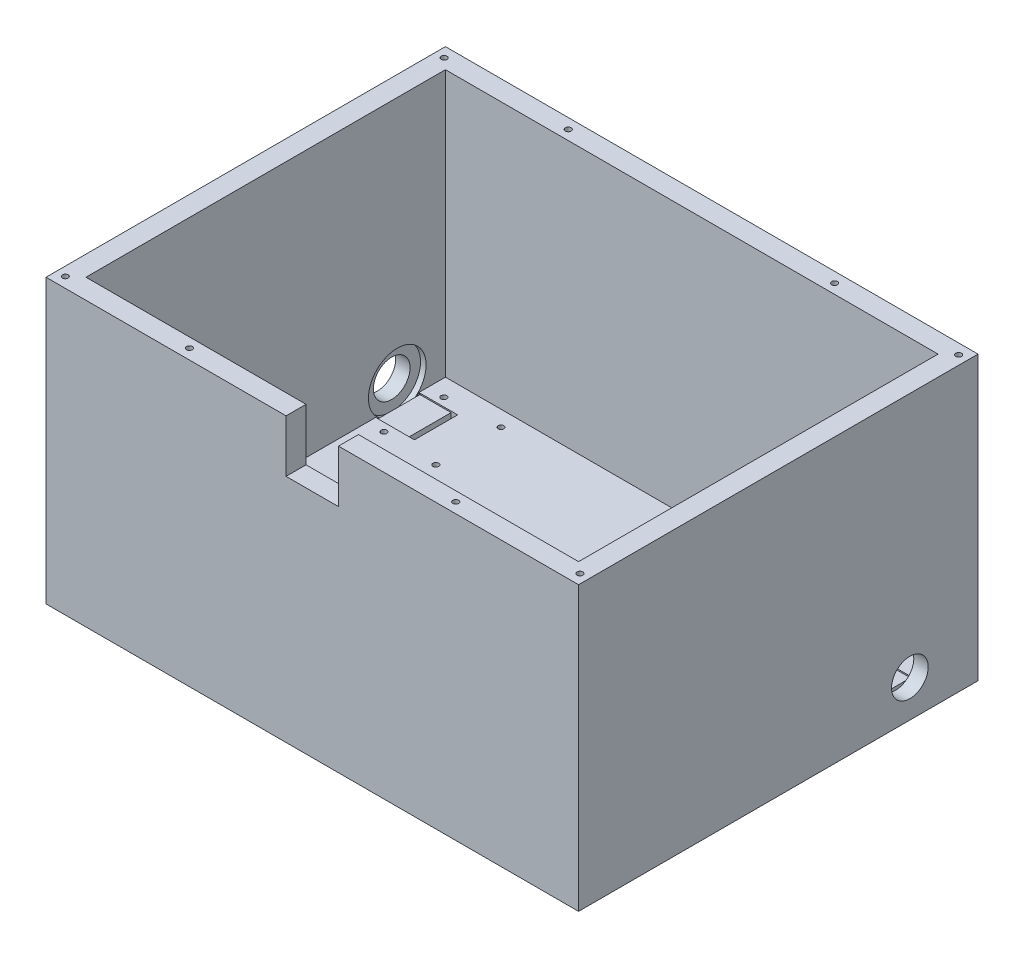
from build123d import *
from build123d.topology import SkipClean

# Parameters (mm, degrees)
BOSS_EXTRUDE1_DEPTH     = 6.35
SKETCH2_W               = 203.2
SKETCH2_H               = 152.4
SKETCH2_R               = 1.1
SKETCH2_W_2             = 187.96
SKETCH2_H_2             = 137.16
BOSS_EXTRUDE2_DEPTH     = 101.6
SKETCH3_R               = 1.1
CUT_EXTRUDE1_DEPTH      = 12.7
CUT_EXTRUDE2_DEPTH      = 7.62
SKETCH6_R               = 11
CUT_EXTRUDE3_DEPTH      = 0.4
CUT_EXTRUDE6_DEPTH      = 3.25
SKETCH6_3_R             = 11
CUT_EXTRUDE16_DEPTH     = 2.12
CUT_EXTRUDE17_DEPTH     = 3.25
CUT_EXTRUDE18_DEPTH     = 0.5
SKETCH7_8_R             = 1.1
CUT_EXTRUDE10_DEPTH     = 3.175
CUT_EXTRUDE22_START     = -7.62
CUT_EXTRUDE22_DEPTH     = 7.62
CUT_EXTRUDE24_DEPTH     = 2.12
SKETCH20_W              = 0.4
SKETCH20_H              = 15.612494996
CUT_EXTRUDE26_DEPTH     = 3.25
CUT_EXTRUDE27_DEPTH     = 0.5
CUT_EXTRUDE28_DEPTH     = 3.25
SKETCH20_7_R            = 1.1
CUT_EXTRUDE29_DEPTH     = 3.175
SKETCH21_W              = 10
SKETCH21_H              = 20
CUT_EXTRUDE31_DEPTH     = 7.62
CUT_EXTRUDE32_START     = -6.35
CUT_EXTRUDE32_OUTLINE_R = 1.1
CUT_EXTRUDE32_DEPTH     = 3.175
CUT_EXTRUDE33_START     = -6.35
CUT_EXTRUDE33_OUTLINE_R = 1.1
CUT_EXTRUDE33_DEPTH     = 3.175
SKETCH20_9_R            = 1.1
CUT_EXTRUDE34_DEPTH     = 10.16


# Read off the part's stored shape, not the designer's step: Cut-Extrude32, Cut-Extrude33
with BuildPart() as part:
    # Sketch1 → Boss-Extrude1 (new body)
    with BuildSketch(Plane(origin=(0, 0, 0), x_dir=(1, 0, 0), z_dir=(0, 1, 0))):
        Polygon((0.000990329, 152.399052943), (0, 152.399052943), (0, 0), (203.2, 0), (203.2, 152.4), (0.000990329, 152.4), align=None)
    extrude(amount=BOSS_EXTRUDE1_DEPTH)

    # Sketch2 → Boss-Extrude2 (add)
    with BuildSketch(Plane(origin=(0, 6.35, 0), x_dir=(1, 0, 0), z_dir=(0, 1, 0))):
        with Locations((101.6, 76.2)):
            Rectangle(SKETCH2_W, SKETCH2_H)
        with Locations(Location((3.434665978, 148.463788162, 0), (0, 0, 270))):
            Circle(SKETCH2_R, mode=Mode.SUBTRACT)
        with Locations(Location((50.8, 148.463788162, 0), (0, 0, 270))):
            Circle(SKETCH2_R, mode=Mode.SUBTRACT)
        with Locations(Location((199.765334022, 148.463788162, 0), (0, 0, 270))):
            Circle(SKETCH2_R, mode=Mode.SUBTRACT)
        with Locations(Location((152.4, 148.463788162, 0), (0, 0, 270))):
            Circle(SKETCH2_R, mode=Mode.SUBTRACT)
        with Locations(Location((3.434665978, 3.936211838, 0), (0, 0, 270))):
            Circle(SKETCH2_R, mode=Mode.SUBTRACT)
        with Locations(Location((50.8, 3.936211838, 0), (0, 0, 270))):
            Circle(SKETCH2_R, mode=Mode.SUBTRACT)
        with Locations(Location((199.765334022, 3.936211838, 0), (0, 0, 270))):
            Circle(SKETCH2_R, mode=Mode.SUBTRACT)
        with Locations(Location((152.4, 3.936211838, 0), (0, 0, 270))):
            Circle(SKETCH2_R, mode=Mode.SUBTRACT)
        with Locations((101.6, 76.2)):
            Rectangle(SKETCH2_W_2, SKETCH2_H_2, mode=Mode.SUBTRACT)
    extrude(amount=BOSS_EXTRUDE2_DEPTH)

    # Sketch3 → Cut-Extrude1 (cut)
    with SkipClean():  # the faces are left unmerged after this step: merging them gives an invalid solid
        with BuildSketch(Plane.XZ):
            with Locations(Location((3.434665978, -3.936211838, 0), (0, 0, 270))):
                Circle(SKETCH3_R)
            with Locations(Location((50.8, -3.936211838, 0), (0, 0, 270))):
                Circle(SKETCH3_R)
            with Locations(Location((152.4, -3.936211838, 0), (0, 0, 270))):
                Circle(SKETCH3_R)
            with Locations(Location((199.765334022, -3.936211838, 0), (0, 0, 270))):
                Circle(SKETCH3_R)
            with Locations(Location((50.800247582, -148.463314633, 0), (0, 0, 270))):
                Circle(SKETCH3_R)
            with Locations(Location((3.434665978, -148.463314633, 0), (0, 0, 270))):
                Circle(SKETCH3_R)
            with Locations(Location((152.4, -148.463314633, 0), (0, 0, 270))):
                Circle(SKETCH3_R)
            with Locations(Location((199.765334022, -148.463314633, 0), (0, 0, 270))):
                Circle(SKETCH3_R)
        extrude(amount=-CUT_EXTRUDE1_DEPTH, mode=Mode.SUBTRACT)
    add(part.part.scale(1), mode=Mode.REPLACE)  # the faces are merged on a copy

    # Sketch5 → Cut-Extrude2 (cut)
    with BuildSketch(Plane(origin=(203.2, 0, 0), x_dir=(0, 0, -1), z_dir=(1, 0, 0))):
        with BuildLine():
            ThreePointArc((126.4, 7.09999974), (131.349747468, 9.150252272), (133.4, 14.09999974))
            Line((133.4, 14.09999974), (126.4, 14.09999974))
            Line((126.4, 14.09999974), (126.4, 7.09999974))
        make_face()
        with BuildLine():
            Line((126.4, 14.09999974), (133.4, 14.09999974))
            ThreePointArc((133.4, 14.09999974), (121.450252532, 19.049747208), (126.4, 7.09999974))
            Line((126.4, 7.09999974), (126.4, 14.09999974))
        make_face()
    extrude(amount=-CUT_EXTRUDE2_DEPTH, mode=Mode.SUBTRACT)

    # Sketch6 → Cut-Extrude3 (cut)
    with BuildSketch(Plane.ZY.offset(-195.58)):
        with Locations((-126.4, 14.09999974)):
            Circle(SKETCH6_R)
    extrude(amount=-CUT_EXTRUDE3_DEPTH, mode=Mode.SUBTRACT)

    # Sketch7 → Cut-Extrude6 (cut)
    with BuildSketch(Plane(origin=(0, 6.35, 0), x_dir=(1, 0, 0), z_dir=(0, 1, 0))):
        Polygon((176.812976287, 126.4), (176.812976287, 118.15), (179.312976287, 118.15), (179.312976287, 126.4), (179.312976287, 134.65), (176.812976287, 134.65), align=None)
    extrude(amount=-CUT_EXTRUDE6_DEPTH, mode=Mode.SUBTRACT)

    # Sketch6<3> → Cut-Extrude16 (cut)
    with BuildSketch(Plane.ZY.offset(-195.58)):
        with Locations((-126.4, 14.09999974)):
            Circle(SKETCH6_3_R)
    extrude(amount=-CUT_EXTRUDE16_DEPTH, mode=Mode.SUBTRACT)

    # Sketch7<9> → Cut-Extrude17 (cut)
    with BuildSketch(Plane(origin=(0, 6.35, 0), x_dir=(1, 0, 0), z_dir=(0, 1, 0))):
        Polygon((195.2, 118.593752244), (195.2, 126.4), (195.2, 134.206247756), (195.58, 134.206247756), (195.58, 118.593752244), align=None)
    extrude(amount=-CUT_EXTRUDE17_DEPTH, mode=Mode.SUBTRACT)

    # Sketch7<10> → Cut-Extrude18 (cut)
    with BuildSketch(Plane(origin=(0, 6.35, 0), x_dir=(1, 0, 0), z_dir=(0, 1, 0))):
        Polygon((179.312976287, 118.15), (195.2, 118.15), (195.2, 118.593752244), (195.2, 126.4), (195.2, 134.206247756), (195.2, 134.65), (179.312976287, 134.65), (179.312976287, 126.4), align=None)
    extrude(amount=-CUT_EXTRUDE18_DEPTH, mode=Mode.SUBTRACT)

    # Sketch7<8> → Cut-Extrude10 (cut)
    with BuildSketch(Plane(origin=(0, 6.35, 0), x_dir=(1, 0, 0), z_dir=(0, 1, 0))):
        with Locations(Location((187.256488143, 137.825, 0), (0, 0, 270))):
            Circle(SKETCH7_8_R)
        with Locations(Location((187.256488143, 114.975, 0), (0, 0, 270))):
            Circle(SKETCH7_8_R)
        with Locations(Location((164.462976287, 138.19, 0), (0, 0, 270))):
            Circle(SKETCH7_8_R)
        with Locations(Location((164.462976287, 114.61, 0), (0, 0, 270))):
            Circle(SKETCH7_8_R)
    extrude(amount=-CUT_EXTRUDE10_DEPTH, mode=Mode.SUBTRACT)

    # Sketch17 → Cut-Extrude22 (cut)
    with BuildSketch(Plane.ZY.offset(CUT_EXTRUDE22_START)):
        with BuildLine():
            ThreePointArc((-119.4, 14.1), (-126.4, 21.1), (-133.4, 14.1))
            Line((-133.4, 14.1), (-126.4, 14.1))
            Line((-126.4, 14.1), (-126.4, 7.1))
            ThreePointArc((-126.4, 7.1), (-121.450252532, 9.150252532), (-119.4, 14.1))
        make_face()
        with BuildLine():
            Line((-126.4, 14.1), (-133.4, 14.1))
            ThreePointArc((-133.4, 14.1), (-131.349747468, 9.150252532), (-126.4, 7.1))
            Line((-126.4, 7.1), (-126.4, 14.1))
        make_face()
    extrude(amount=CUT_EXTRUDE22_DEPTH, mode=Mode.SUBTRACT)

    # Sketch18 → Cut-Extrude24 (cut)
    # profile 1 of 2: a face of its own
    with BuildSketch(Plane(origin=(7.62, 0, 0), x_dir=(0, 0, -1), z_dir=(1, 0, 0))):
        with BuildLine():
            ThreePointArc((134.206247498, 6.35), (136.570268494, 9.908861878), (137.4, 14.1))
            ThreePointArc((137.4, 14.1), (122.208861878, 24.270268494), (118.593752502, 6.35))
            Line((118.593752502, 6.35), (134.206247498, 6.35))
        make_face()
        with BuildLine():
            ThreePointArc((133.4, 14.1), (131.349747468, 9.150252532), (126.4, 7.1))
            ThreePointArc((126.4, 7.1), (119.4, 14.1), (126.4, 21.1))
            ThreePointArc((126.4, 21.1), (131.349747468, 19.049747468), (133.4, 14.1))
        make_face(mode=Mode.SUBTRACT)
    # profile 2 of 2: a face of its own
    with BuildSketch(Plane(origin=(7.62, 0, 0), x_dir=(0, 0, -1), z_dir=(1, 0, 0))):
        with BuildLine():
            Line((134.206247498, 6.35), (118.593752502, 6.35))
            ThreePointArc((118.593752502, 6.35), (126.4, 3.1), (134.206247498, 6.35))
        make_face()
    extrude(amount=-CUT_EXTRUDE24_DEPTH, mode=Mode.SUBTRACT)

    # Sketch20 → Cut-Extrude26 (cut)
    with BuildSketch(Plane(origin=(0, 6.35, 0), x_dir=(1, 0, 0), z_dir=(0, 1, 0))):
        with Locations((7.82, 126.4)):
            Rectangle(SKETCH20_W, SKETCH20_H)
    extrude(amount=-CUT_EXTRUDE26_DEPTH, mode=Mode.SUBTRACT)

    # Sketch20<4> → Cut-Extrude27 (cut)
    with BuildSketch(Plane(origin=(0, 6.35, 0), x_dir=(1, 0, 0), z_dir=(0, 1, 0))):
        Polygon((8.02, 118.15), (8.02, 118.593752502), (8.02, 134.206247498), (8.02, 134.65), (19.92, 134.65), (19.92, 126.4), (19.92, 118.15), align=None)
    extrude(amount=-CUT_EXTRUDE27_DEPTH, mode=Mode.SUBTRACT)

    # Sketch20<5> → Cut-Extrude28 (cut)
    with BuildSketch(Plane(origin=(0, 6.35, 0), x_dir=(1, 0, 0), z_dir=(0, 1, 0))):
        Polygon((19.92, 118.15), (22.42, 118.15), (22.42, 126.4), (22.42, 134.65), (19.92, 134.65), (19.92, 126.4), align=None)
    extrude(amount=-CUT_EXTRUDE28_DEPTH, mode=Mode.SUBTRACT)

    # Sketch20<7> → Cut-Extrude29 (cut)
    with BuildSketch(Plane(origin=(0, 6.35, 0), x_dir=(1, 0, 0), z_dir=(0, 1, 0))):
        with Locations(Location((13.97, 137.825, 0), (0, 0, 270))):
            Circle(SKETCH20_7_R)
        with Locations(Location((13.97, 114.975, 0), (0, 0, 270))):
            Circle(SKETCH20_7_R)
        with Locations(Location((34.77, 138.825, 0), (0, 0, 270))):
            Circle(SKETCH20_7_R)
    extrude(amount=-CUT_EXTRUDE29_DEPTH, mode=Mode.SUBTRACT)

    # Sketch21 → Cut-Extrude31 (cut)
    with BuildSketch(Plane.XY):
        with Locations((96.6, 97.95)):
            Rectangle(SKETCH21_W, SKETCH21_H)
        Polygon((111.6, 107.95), (101.6, 107.95), (101.6, 87.95), (111.6, 87.95), (111.6, 88.914389003), align=None)
    extrude(amount=-CUT_EXTRUDE31_DEPTH, mode=Mode.SUBTRACT)

    # Cut-Extrude32 outline → Cut-Extrude32 (cut)
    with BuildSketch(Plane(origin=(0, 6.35, 0), x_dir=(1, 0, 0), z_dir=(0, 1, 0)).offset(CUT_EXTRUDE32_START)):
        with Locations((13.97, 137.825)):
            Circle(CUT_EXTRUDE32_OUTLINE_R)
        with Locations((34.77, 138.825)):
            Circle(CUT_EXTRUDE32_OUTLINE_R)
        with Locations((13.97, 114.975)):
            Circle(CUT_EXTRUDE32_OUTLINE_R)
    extrude(amount=CUT_EXTRUDE32_DEPTH, mode=Mode.SUBTRACT)

    # Cut-Extrude33 outline → Cut-Extrude33 (cut)
    with BuildSketch(Plane(origin=(0, 6.35, 0), x_dir=(1, 0, 0), z_dir=(0, 1, 0)).offset(CUT_EXTRUDE33_START)):
        with Locations((164.462976287, 138.19)):
            Circle(CUT_EXTRUDE33_OUTLINE_R)
        with Locations((164.462976287, 114.61)):
            Circle(CUT_EXTRUDE33_OUTLINE_R)
        with Locations((187.256488143, 114.975)):
            Circle(CUT_EXTRUDE33_OUTLINE_R)
        with Locations((187.256488143, 137.825)):
            Circle(CUT_EXTRUDE33_OUTLINE_R)
    extrude(amount=CUT_EXTRUDE33_DEPTH, mode=Mode.SUBTRACT)

    # Sketch20<9> → Cut-Extrude34 (cut)
    with BuildSketch(Plane(origin=(0, 6.35, 0), x_dir=(1, 0, 0), z_dir=(0, 1, 0))):
        with Locations(Location((34.77, 113.975, 0), (0, 0, 270))):
            Circle(SKETCH20_9_R)
    extrude(amount=-CUT_EXTRUDE34_DEPTH, mode=Mode.SUBTRACT)


solid = part.part
